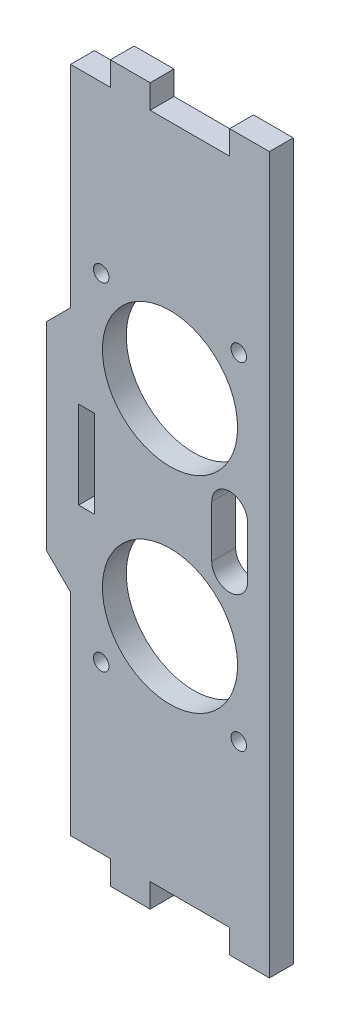
from build123d import *

# Parameters (mm, degrees)
CROQUIS2_W              = 25
CROQUIS2_H              = 90
SALIENTE_EXTRUIR1_DEPTH = 3
CROQUIS3_W              = 10
CROQUIS3_H              = 3
CROQUIS3_W_2            = 5
CORTAR_EXTRUIR1_DEPTH   = 47.800106837
CROQUIS5_R              = 8.5
CROQUIS5_R_2            = 0.975
CORTAR_EXTRUIR2_DEPTH   = 47.800106837
CROQUIS6_W              = 2
CROQUIS6_H              = 11
CORTAR_EXTRUIR3_DEPTH   = 10
CROQUIS7_W              = 3
CROQUIS7_H              = 25
SALIENTE_EXTRUIR2_DEPTH = 3
CHAFL_N1_SIZE           = 3


with BuildPart() as part:
    # Croquis2 → Saliente-Extruir1 (new body)
    with BuildSketch(Plane.XY):
        Rectangle(CROQUIS2_W, CROQUIS2_H)
    extrude(amount=SALIENTE_EXTRUIR1_DEPTH)

    # Croquis3 → Cortar-Extruir1 (cut, through all)
    with BuildSketch(Plane.XY):
        with Locations((2.5, 43.5)):
            Rectangle(CROQUIS3_W, CROQUIS3_H)
        with Locations((-10, 43.5)):
            Rectangle(CROQUIS3_W_2, CROQUIS3_H)
    cortar_extruir1 = extrude(amount=CORTAR_EXTRUIR1_DEPTH, mode=Mode.SUBTRACT)

    # Simetría2: Cortar-Extruir1 across plane
    add(cortar_extruir1.mirror(Plane.ZX), mode=Mode.SUBTRACT)

    # Croquis5 → Cortar-Extruir2 (cut, through all)
    with BuildSketch(Plane.XY):
        with Locations((0, 12.95)):
            Circle(CROQUIS5_R)
        with Locations((0, -12.95)):
            Circle(CROQUIS5_R)
        with Locations((-8.65, 21.175)):
            Circle(CROQUIS5_R_2)
        with Locations((8.65, 21.175)):
            Circle(CROQUIS5_R_2)
        with Locations((8.65, -21.175)):
            Circle(CROQUIS5_R_2)
        with Locations((-8.65, -21.175)):
            Circle(CROQUIS5_R_2)
        with BuildLine():
            Line((9.75, -3.25), (9.75, 3.25))
            ThreePointArc((9.75, 3.25), (7.5, 5.5), (5.25, 3.25))
            Line((5.25, 3.25), (5.25, -3.25))
            ThreePointArc((5.25, -3.25), (7.5, -5.5), (9.75, -3.25))
        make_face()
    extrude(amount=CORTAR_EXTRUIR2_DEPTH, mode=Mode.SUBTRACT)

    # Croquis6 → Cortar-Extruir3 (cut)
    with BuildSketch(Plane.XY):
        with Locations((-10.5, 0)):
            Rectangle(CROQUIS6_W, CROQUIS6_H)
    extrude(amount=CORTAR_EXTRUIR3_DEPTH, mode=Mode.SUBTRACT)

    # Croquis7 → Saliente-Extruir2 (add)
    with BuildSketch(Plane.XY):
        with Locations((-14, 0)):
            Rectangle(CROQUIS7_W, CROQUIS7_H)
    extrude(amount=SALIENTE_EXTRUIR2_DEPTH)

    # Chaflán1
    chafl_n1_edges = [part.edges().sort_by_distance(p)[0] for p in [
        (-12.5, -12.5, 1.5),
        (-12.5, 12.5, 1.5),
    ]]
    chamfer(chafl_n1_edges, length=CHAFL_N1_SIZE - 0.0001)  # a hair under: the kernel refuses the full size


solid = part.part
